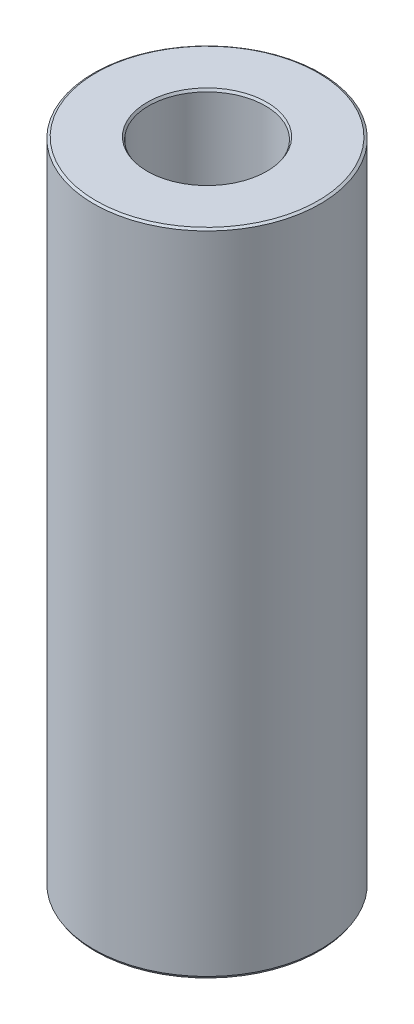
from build123d import *
from OCP.BRepFilletAPI import BRepFilletAPI_MakeChamfer

# Parameters (mm, degrees)
SKETCH1_R           = 55
BOSS_EXTRUDE1_DEPTH = 315.169408489
SKETCH2_R           = 28.311486336
CUT_EXTRUDE1_DEPTH  = 325.625562837
CHAMFER1_SIZE       = 0.726387636
CHAMFER1_SIZE2      = 1.155746778


with BuildPart() as part:
    # Sketch1 → Boss-Extrude1 (new body)
    with BuildSketch(Plane(origin=(0, 0, 0), x_dir=(1, 0, 0), z_dir=(0, 1, 0))):
        Circle(SKETCH1_R)
    extrude(amount=BOSS_EXTRUDE1_DEPTH)

    # Sketch2 → Cut-Extrude1 (cut, through all)
    with BuildSketch(Plane(origin=(0, 0, 0), x_dir=(1, 0, 0), z_dir=(0, 1, 0))):
        Circle(SKETCH2_R)
    extrude(amount=CUT_EXTRUDE1_DEPTH, mode=Mode.SUBTRACT)

    # Chamfer1: one chamfer whose edges measure the first distance from different faces: ONE call of the kernel's chamfer builder (chamfer() names one face for all edges)
    chamfer1_edges_1 = [part.edges().sort_by_distance(p)[0] for p in [
        (-28.311486336, 315.169408489, 0),
    ]]
    chamfer1_side_1 = [part.faces().sort_by_distance(p)[0] for p in [
        (-53.444365081, 315.169408489, 0),
    ]]
    chamfer1_edges_2 = [part.edges().sort_by_distance(p)[0] for p in [
        (-28.311486336, 0, 0),
    ]]
    chamfer1_side_2 = [part.faces().sort_by_distance(p)[0] for p in [
        (-28.311486336, 157.584704245, 0),
    ]]
    chamfer1_edges_3 = [part.edges().sort_by_distance(p)[0] for p in [
        (-55, 0, 0),
    ]]
    chamfer1_side_3 = [part.faces().sort_by_distance(p)[0] for p in [
        (-53.444365081, 0, 0),
    ]]
    chamfer1_edges_4 = [part.edges().sort_by_distance(p)[0] for p in [
        (-55, 315.169408489, 0),
    ]]
    chamfer1_side_4 = [part.faces().sort_by_distance(p)[0] for p in [
        (-55, 157.584704245, 0),
    ]]
    chamfer1 = BRepFilletAPI_MakeChamfer(part.part.solid().wrapped)
    for e in chamfer1_edges_1:
        chamfer1.Add(CHAMFER1_SIZE, CHAMFER1_SIZE2, e.wrapped, chamfer1_side_1[0].wrapped)  # the first distance lies on this face
    for e in chamfer1_edges_2:
        chamfer1.Add(CHAMFER1_SIZE, CHAMFER1_SIZE2, e.wrapped, chamfer1_side_2[0].wrapped)  # the first distance lies on this face
    for e in chamfer1_edges_3:
        chamfer1.Add(CHAMFER1_SIZE, CHAMFER1_SIZE2, e.wrapped, chamfer1_side_3[0].wrapped)  # the first distance lies on this face
    for e in chamfer1_edges_4:
        chamfer1.Add(CHAMFER1_SIZE, CHAMFER1_SIZE2, e.wrapped, chamfer1_side_4[0].wrapped)  # the first distance lies on this face
    add(Compound.cast(chamfer1.Shape()), mode=Mode.REPLACE)


solid = part.part
